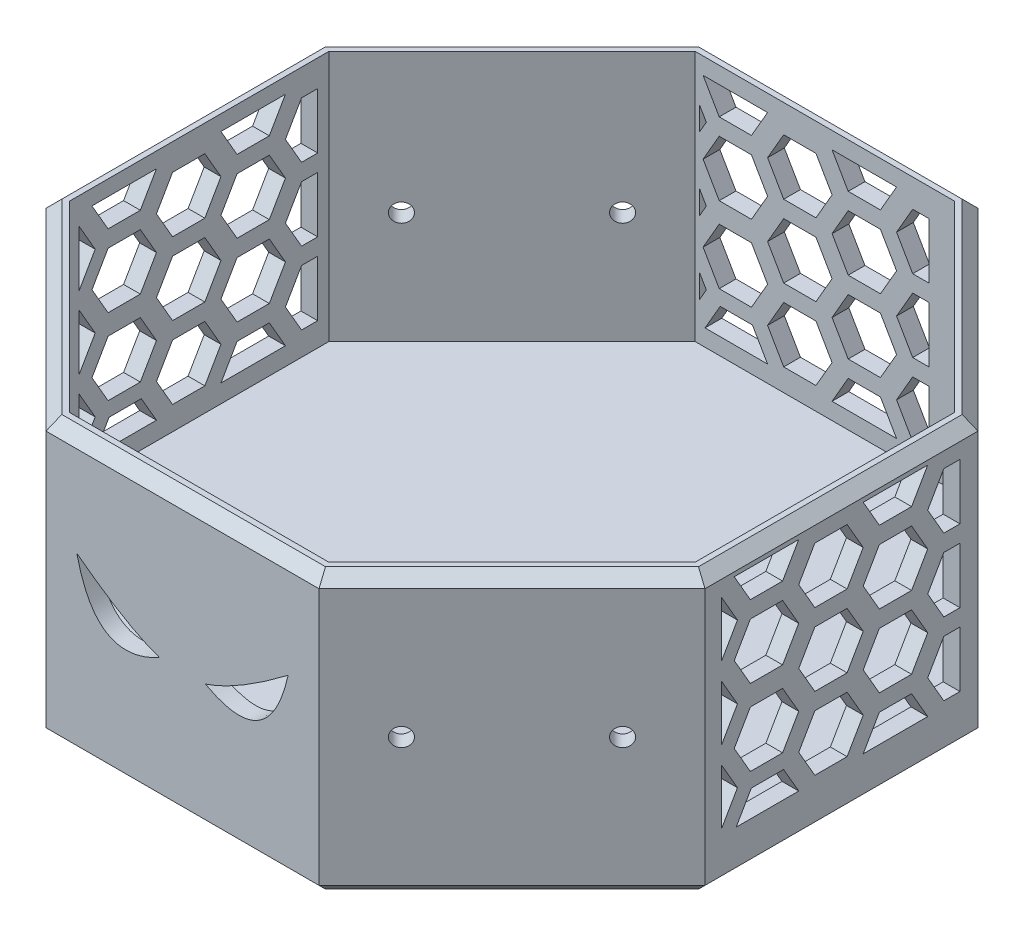
from build123d import *

# Parameters (mm, degrees)
RESSALTO_EXTRUS_O1_DEPTH = 50
CORTE_EXTRUS_O2_DEPTH    = 45
ESBO_O14_R               = 1.65
CORTE_EXTRUS_O6_DEPTH    = 151.959447605
ESBO_O15_R               = 1.65
CORTE_EXTRUS_O7_DEPTH    = 151.959447605
CHANFRO1_SIZE            = 2
CORTE_EXTRUS_O3_DEPTH    = 142.085080714
CORTE_EXTRUS_O4_DEPTH    = 10
CORTE_EXTRUS_O5_DEPTH    = 10


with BuildPart() as part:
    # Esboço1 → Ressalto-extrusão1 (new body)
    with BuildSketch(Plane(origin=(0, 0, 0), x_dir=(1, 0, 0), z_dir=(0, 1, 0))):
        Polygon((59, -24.43860018), (59, 24.43860018), (24.43860018, 59), (-24.43860018, 59), (-59, 24.43860018), (-59, -24.43860018), (-24.43860018, -59), (24.43860018, -59), align=None)
    extrude(amount=RESSALTO_EXTRUS_O1_DEPTH)

    # Esboço2 → Corte-extrusão2 (cut)
    with BuildSketch(Plane(origin=(0, 50, 0), x_dir=(1, 0, 0), z_dir=(0, 1, 0))):
        Polygon((56, 23.195959493), (23.195959493, 56), (-23.195959493, 56), (-56, 23.195959493), (-56, -23.195959493), (-23.195959493, -56), (23.195959493, -56), (56, -23.195959493), align=None)
    extrude(amount=-CORTE_EXTRUS_O2_DEPTH, mode=Mode.SUBTRACT)

    # Esboço14 → Corte-extrusão6 (cut, through all)
    with BuildSketch(Plane(origin=(-41.71930009, 0, 41.71930009), x_dir=(0.7071067811865474, 0, 0.7071067811865477), z_dir=(-0.7071067811865477, 0, 0.7071067811865474))):
        with Locations((-14, 25)):
            Circle(ESBO_O14_R)
        with Locations((14, 25)):
            Circle(ESBO_O14_R)
    extrude(amount=-CORTE_EXTRUS_O6_DEPTH, mode=Mode.SUBTRACT)

    # Esboço15 → Corte-extrusão7 (cut, through all)
    with BuildSketch(Plane(origin=(-41.71930009, 0, -41.71930009), x_dir=(-0.7071067811865478, 0, 0.7071067811865472), z_dir=(-0.7071067811865472, 0, -0.7071067811865478))):
        with Locations((-14, 25)):
            Circle(ESBO_O15_R)
        with Locations((14, 25)):
            Circle(ESBO_O15_R)
    extrude(amount=-CORTE_EXTRUS_O7_DEPTH, mode=Mode.SUBTRACT)

    # Chanfro1
    chanfro1_edges = [part.edges().sort_by_distance(p)[0] for p in [
        (-59, 0, 0),
        (-41.71930009, 0, -41.71930009),
        (0, 0, -59),
        (41.71930009, 0, -41.71930009),
        (59, 0, 0),
        (41.71930009, 0, 41.71930009),
        (0, 0, 59),
        (-41.71930009, 0, 41.71930009),
        (41.71930009, 50, 41.71930009),
        (59, 50, 0),
        (41.71930009, 50, -41.71930009),
        (0, 50, -59),
        (-41.71930009, 50, -41.71930009),
        (-59, 50, 0),
        (-41.71930009, 50, 41.71930009),
        (0, 50, 59),
    ]]
    chamfer(chanfro1_edges, length=CHANFRO1_SIZE)

    # Esboço11 → Corte-extrusão3 (cut, through all)
    with BuildSketch(Plane.ZY.offset(59)):
        Polygon((18.862017185, 8.239613046), (16.148516283, 12.939534476), (10.375013591, 12.939534476), (7.661512689, 8.239613046), align=None)
        Polygon((7.661512689, 27.239613046), (4.774761343, 32.239613046), (-0.998741349, 32.239613046), (-3.885492695, 27.239613046), (-0.998741349, 22.239613046), (4.774761343, 22.239613046), align=None)
        Polygon((-3.885492695, 21.239613046), (-6.772244041, 26.239613046), (-12.545746733, 26.239613046), (-15.432498079, 21.239613046), (-12.545746733, 16.239613046), (-6.772244041, 16.239613046), align=None)
        Polygon((7.661512689, 40.239613046), (4.774761343, 45.239613046), (-0.998741349, 45.239613046), (-3.885492695, 40.239613046), (-0.998741349, 35.239613046), (4.774761343, 35.239613046), align=None)
        Polygon((7.661512689, 14.239613046), (4.774761343, 19.239613046), (-0.998741349, 19.239613046), (-3.885492695, 14.239613046), (-0.998741349, 9.239613046), (4.774761343, 9.239613046), align=None)
        Polygon((-15.432498079, 8.239613046), (-3.885492695, 8.239613046), (-6.772244041, 13.239613046), (-12.545746733, 13.239613046), align=None)
        Polygon((-15.432498079, 47.239613046), (-3.885492695, 47.239613046), (-6.772244041, 42.239613046), (-12.545746733, 42.239613046), align=None)
        Polygon((-3.885492695, 34.239613046), (-6.772244041, 39.239613046), (-12.545746733, 39.239613046), (-15.432498079, 34.239613046), (-12.545746733, 29.239613046), (-6.772244041, 29.239613046), align=None)
        Polygon((-21.206000771, 45.239613046), (-21.206000771, 35.239613046), (-18.319249425, 35.239613046), (-15.432498079, 40.239613046), (-18.319249425, 45.239613046), align=None)
        Polygon((-15.432498079, 27.239613046), (-18.319249425, 32.239613046), (-21.206000771, 32.239613046), (-21.206000771, 22.239613046), (-18.319249425, 22.239613046), align=None)
        Polygon((-15.432498079, 14.239613046), (-18.319249425, 19.239613046), (-21.206000771, 19.239613046), (-21.206000771, 9.239613046), (-18.319249425, 9.239613046), align=None)
        Polygon((19.208518072, 34.239613046), (16.321766726, 39.239613046), (10.548264034, 39.239613046), (7.661512689, 34.239613046), (10.548264034, 29.239613046), (16.321766726, 29.239613046), align=None)
        Polygon((7.661512689, 47.239613046), (10.548264034, 42.239613046), (16.321766726, 42.239613046), (19.208518072, 47.239613046), align=None)
        Polygon((21.517919149, 45.239613046), (21.517919149, 35.239613046), (18.631167803, 40.239613046), align=None)
        Polygon((19.208518072, 20.602829594), (16.321766726, 25.602829594), (10.548264034, 25.602829594), (7.661512689, 20.602829594), (10.548264034, 15.602829594), (16.321766726, 15.602829594), align=None)
        Polygon((21.517919149, 32.239613046), (21.517919149, 22.239613046), (18.631167803, 27.239613046), align=None)
        Polygon((21.517919149, 19.239613046), (21.517919149, 9.239613046), (18.631167803, 14.239613046), align=None)
    extrude(amount=-CORTE_EXTRUS_O3_DEPTH, mode=Mode.SUBTRACT)

    # Esboço12 → Corte-extrusão4 (cut)
    with BuildSketch(Plane(origin=(0, 0, -59), x_dir=(-1, 0, 0), z_dir=(0, 0, -1))):
        Polygon((21.43860018, 8), (18.725099278, 12.699921429), (12.951596586, 12.699921429), (10.238095683, 8), align=None)
        Polygon((10.238095683, 27), (7.351344337, 32), (1.577841645, 32), (-1.3089097, 27), (1.577841645, 22), (7.351344337, 22), align=None)
        Polygon((-1.3089097, 21), (-4.195661046, 26), (-9.969163738, 26), (-12.855915084, 21), (-9.969163738, 16), (-4.195661046, 16), align=None)
        Polygon((10.238095683, 40), (7.351344337, 45), (1.577841645, 45), (-1.3089097, 40), (1.577841645, 35), (7.351344337, 35), align=None)
        Polygon((10.238095683, 14), (7.351344337, 19), (1.577841645, 19), (-1.3089097, 14), (1.577841645, 9), (7.351344337, 9), align=None)
        Polygon((-12.855915084, 8), (-1.3089097, 8), (-4.195661046, 13), (-9.969163738, 13), align=None)
        Polygon((-12.855915084, 47), (-1.3089097, 47), (-4.195661046, 42), (-9.969163738, 42), align=None)
        Polygon((-1.3089097, 34), (-4.195661046, 39), (-9.969163738, 39), (-12.855915084, 34), (-9.969163738, 29), (-4.195661046, 29), align=None)
        Polygon((-18.629417776, 45), (-18.629417776, 35), (-15.74266643, 35), (-12.855915084, 40), (-15.74266643, 45), align=None)
        Polygon((-12.855915084, 27), (-15.74266643, 32), (-18.629417776, 32), (-18.629417776, 22), (-15.74266643, 22), align=None)
        Polygon((-12.855915084, 14), (-15.74266643, 19), (-18.629417776, 19), (-18.629417776, 9), (-15.74266643, 9), align=None)
        Polygon((21.785101067, 34), (18.898349721, 39), (13.124847029, 39), (10.238095683, 34), (13.124847029, 29), (18.898349721, 29), align=None)
        Polygon((10.238095683, 47), (13.124847029, 42), (18.898349721, 42), (21.785101067, 47), align=None)
        Polygon((22.437647894, 42.130244259), (22.437647894, 37.869755741), (21.207750798, 40), align=None)
        Polygon((21.785101067, 20.363216547), (18.898349721, 25.363216547), (13.124847029, 25.363216547), (10.238095683, 20.363216547), (13.124847029, 15.363216547), (18.898349721, 15.363216547), align=None)
        Polygon((22.437647894, 29.130244259), (22.437647894, 24.869755741), (21.207750798, 27), align=None)
        Polygon((22.437647894, 16.130244259), (22.437647894, 11.869755741), (21.207750798, 14), align=None)
    extrude(amount=-CORTE_EXTRUS_O4_DEPTH, mode=Mode.SUBTRACT)

    # Esboço13 → Corte-extrusão5 (cut)
    with BuildSketch(Plane.XY.offset(59)):
        with BuildLine():
            add(Edge.make_bspline(
                [(-18.917899523, 31.812800079), (-9.790862328, 24.903720312), (-4.10744427, 23.050598788)],
                knots=[0, 0, 0, 1, 1, 1], degree=2))
            add(Edge.make_bspline(
                [(-18.917899523, 31.812800079), (-15.516774887, 16.806948828), (-4.10744427, 23.050598788)],
                knots=[0, 0, 0, 1, 1, 1], degree=2))
        make_face()
        with BuildLine():
            add(Edge.make_bspline(
                [(18.917899523, 31.812800079), (9.790862328, 24.903720312), (4.10744427, 23.050598788)],
                knots=[0, 0, 0, 1, 1, 1], degree=2))
            add(Edge.make_bspline(
                [(18.917899523, 31.812800079), (15.516774887, 16.806948828), (4.10744427, 23.050598788)],
                knots=[0, 0, 0, 1, 1, 1], degree=2))
        make_face()
    extrude(amount=-CORTE_EXTRUS_O5_DEPTH, mode=Mode.SUBTRACT)


solid = part.part
